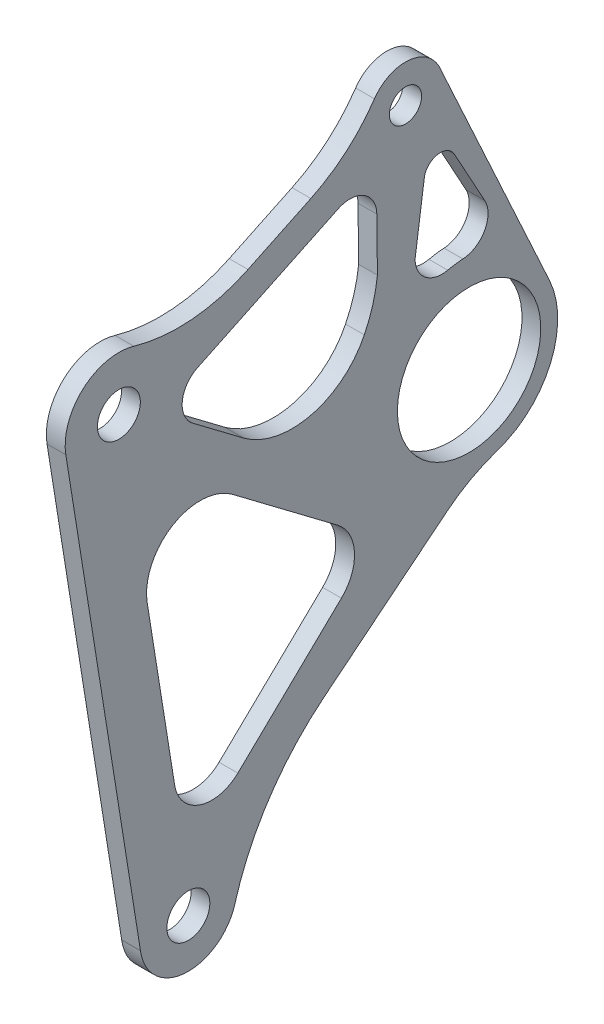
from build123d import *

# Parameters (mm, degrees)
SZKIC7_W                    = 139.266717109
SZKIC7_H                    = 160.929145335
DODANIE_WYCI_GNI_CIE2_DEPTH = 3.5
SZKIC8_R                    = 13.35
SZKIC8_R_2                  = 3
SZKIC8_R_3                  = 4
WYTNIJ_WYCI_GNI_CIE4_DEPTH  = 129.67294198
SZKIC9_W                    = 153.512733411
SZKIC9_H                    = 228.238191402
WYTNIJ_WYCI_GNI_CIE5_DEPTH  = 129.67294198
WYTNIJ_WYCI_GNI_CIE14_DEPTH = 104.40635377
WYTNIJ_WYCI_GNI_CIE15_DEPTH = 104.40635377
ZAOKR_GLENIE11_R            = 30
DODANIE_WYCI_GNI_CIE5_DEPTH = 3.5
ZAOKR_GLENIE14_R            = 5
WYTNIJ_WYCI_GNI_CIE17_DEPTH = 104.40635377
DODANIE_WYCI_GNI_CIE6_DEPTH = 3.5
ZAOKR_GLENIE24_R            = 5
DODANIE_WYCI_GNI_CIE7_DEPTH = 3.5
WYTNIJ_WYCI_GNI_CIE19_START = -10
WYTNIJ_WYCI_GNI_CIE19_DEPTH = 10
ZAOKR_GLENIE45_R            = 50
ZAOKR_GLENIE46_R            = 5
ZAOKR_GLENIE49_R            = 7
DODANIE_WYCI_GNI_CIE8_DEPTH = 3.5
ZAOKR_GLENIE61_R            = 3
ZAOKR_GLENIE62_R            = 5
WYTNIJ_WYCI_GNI_CIE21_DEPTH = 104.40635377
ZAOKR_GLENIE69_R            = 30
ZAOKR_GLENIE72_R            = 10
ZAOKR_GLENIE75_R            = 5
ZAOKR_GLENIE76_R            = 8
ZAOKR_GLENIE77_R            = 15


with BuildPart() as part:
    # Szkic7 → Dodanie-wyciągnięcie2 (new body)
    with BuildSketch(Plane(origin=(-10.54007835, 1.1e-07, -2.52e-07), x_dir=(-2.3878901828089376e-08, 0, 0.9999999999999998), z_dir=(-0.9999999999999998, 1.0404070824565065e-08, -2.387890182808938e-08))):
        with Locations((21.253283054, -10.552427612)):
            Rectangle(SZKIC7_W, SZKIC7_H)
    extrude(amount=DODANIE_WYCI_GNI_CIE2_DEPTH)

    # Szkic8 → Wytnij-wyciągnięcie4 (cut, through all)
    with BuildSketch(Plane(origin=(-14.04007835, 1.46e-07, -3.35e-07), x_dir=(-2.3878901828089376e-08, 0, 0.9999999999999998), z_dir=(-0.9999999999999998, 1.0404070821366677e-08, -2.387890182808938e-08))):
        Circle(SZKIC8_R)
        with Locations((11.844583319, 48.576803579)):
            Circle(SZKIC8_R_2)
        with Locations((65.219786586, 25.423993346)):
            Circle(SZKIC8_R_3)
        with Locations((52.278664472, -61.870358339)):
            Circle(SZKIC8_R_3)
    extrude(amount=-WYTNIJ_WYCI_GNI_CIE4_DEPTH, mode=Mode.SUBTRACT)

    # Szkic9 → Wytnij-wyciągnięcie5 (cut, through all)
    with BuildSketch(Plane(origin=(-14.04007835, 1.46e-07, -3.35e-07), x_dir=(-2.3878901828089376e-08, 0, 0.9999999999999998), z_dir=(-0.9999999999999998, 1.04040708213667e-08, -2.387890182808938e-08))):
        with Locations((22.662126008, 15.447874068)):
            Rectangle(SZKIC9_W, SZKIC9_H)
        with BuildLine():
            Line((-13.382127281, -14.863333052), (46.256707196, -68.558858213))
            ThreePointArc((46.256707196, -68.558858213), (55.372975766, -70.321703653), (61.195751969, -63.089189983))
            Line((61.195751969, -63.089189983), (75.094385693, 23.845293729))
            ThreePointArc((75.094385693, 23.845293729), (73.861369629, 30.456193909), (68.720255549, 34.79131511))
            Line((68.720255549, 34.79131511), (14.519431503, 55.045589184))
            ThreePointArc((14.519431503, 55.045589184), (9.521665371, 55.180140024), (5.708860939, 51.946211669))
            Line((5.708860939, 51.946211669), (-17.530635372, 9.626880256))
            ThreePointArc((-17.530635372, 9.626880256), (-19.719086203, -3.340305273), (-13.382127281, -14.863333052))
        make_face(mode=Mode.SUBTRACT)
    extrude(amount=-WYTNIJ_WYCI_GNI_CIE5_DEPTH, mode=Mode.SUBTRACT)

    # Szkic14 → Wytnij-wyciągnięcie14 (cut, through all)
    with BuildSketch(Plane(origin=(-10.54007835, 1.1e-07, -2.52e-07), x_dir=(2.3878901828089376e-08, 0, -0.9999999999999998), z_dir=(0.9999999999999998, -1.0404070821258326e-08, 2.387890182808938e-08))):
        with BuildLine():
            Line((-64.084108782, 18.320448812), (-52.714951988, -52.792424274))
            Line((-52.714951988, -52.792424274), (-32.631950605, -33.45407936))
            Line((-32.631950605, -33.45407936), (-18.993828244, -20.321644163))
            Line((-18.993828244, -20.321644163), (-23.497433394, -7.529972113))
            ThreePointArc((-23.497433394, -7.529972113), (-20.22176145, 0.243476392), (-16.722321984, 7.918790833))
            ThreePointArc((-16.722321984, 7.918790833), (-6.217208555, 17.426692703), (7.933812077, 16.715200469))
            Line((7.933812077, 16.715200469), (0.329933976, 30.561930754))
            Line((0.329933976, 30.561930754), (-5.626615834, 41.408861433))
            Line((-5.626615834, 41.408861433), (-64.084108782, 18.320448812))
        make_face()
    extrude(amount=-WYTNIJ_WYCI_GNI_CIE14_DEPTH, mode=Mode.SUBTRACT)

    # Szkic18 → Wytnij-wyciągnięcie15 (cut, through all)
    with BuildSketch(Plane(origin=(-10.54007835, 1.1e-07, -2.52e-07), x_dir=(2.3878901833219947e-08, 0, -0.9999999999999997), z_dir=(0.9999999999999997, -1.0404070824107121e-08, 2.3878901833219954e-08))):
        with BuildLine():
            Line((-56.144678545, 29.624280722), (-18.759552018, 47.489049981))
            ThreePointArc((-18.759552018, 47.489049981), (-17.902798902, 52.083657433), (-14.345263169, 55.114892007))
            Line((-14.345263169, 55.114892007), (-18.275031936, 65.389368248))
            Line((-18.275031936, 65.389368248), (-73.458270167, 44.282952603))
            Line((-73.458270167, 44.282952603), (-68.840695847, 34.74542114))
            ThreePointArc((-68.840695847, 34.74542114), (-61.478985752, 34.697957391), (-56.144678545, 29.624280722))
        make_face()
    extrude(amount=-WYTNIJ_WYCI_GNI_CIE15_DEPTH, mode=Mode.SUBTRACT)

    # Zaokrąglenie11
    zaokr_glenie11_edges = [part.edges().sort_by_distance(p)[0] for p in [
        (-12.290078304, 47.489050108, 18.759551724),
        (-12.290079383, 29.62428085, 56.144678252),
    ]]
    fillet(zaokr_glenie11_edges, radius=ZAOKR_GLENIE11_R)

    # Szkic19 → Dodanie-wyciągnięcie5 (add)
    with BuildSketch(Plane(origin=(-10.54007835, 1.1e-07, -2.52e-07), x_dir=(2.3878901833219947e-08, 0, -0.9999999999999997), z_dir=(0.9999999999999997, -1.0404070824107115e-08, 2.3878901833219954e-08))):
        Polygon((-58.946047974, 22.777610248), (-66.322773152, 19.747008618), (-66.720640825, 19.033728733), (-20.22726344, -16.008684341), (-16.035438929, -9.564443008), align=None)
    extrude(amount=-DODANIE_WYCI_GNI_CIE5_DEPTH)

    # Zaokrąglenie14
    zaokr_glenie14_edges = [part.edges().sort_by_distance(p)[0] for p in [
        (-12.290077987, 16.715200597, -7.93381237),
    ]]
    fillet(zaokr_glenie14_edges, radius=ZAOKR_GLENIE14_R)

    # Szkic21 → Wytnij-wyciągnięcie17 (cut, through all)
    with BuildSketch(Plane(origin=(-10.54007835, 1.1e-07, -2.52e-07), x_dir=(2.3878901833219947e-08, 0, -0.9999999999999997), z_dir=(0.9999999999999997, -1.0404070824107095e-08, 2.3878901833219954e-08))):
        with BuildLine():
            Line((-57.747304238, 22.208602164), (-14.808308197, 42.727330539))
            ThreePointArc((-14.808308197, 42.727330539), (-10.724979425, 42.115651428), (-7.085527385, 44.065552465))
            Line((-7.085527385, 44.065552465), (-5.626615834, 41.408861433))
            Line((-5.626615834, 41.408861433), (-56.83244455, 21.184571229))
            Line((-56.83244455, 21.184571229), (-58.018162719, 22.09497171))
            Line((-58.018162719, 22.09497171), (-57.747304238, 22.208602164))
        make_face()
    extrude(amount=-WYTNIJ_WYCI_GNI_CIE17_DEPTH, mode=Mode.SUBTRACT)

    # Szkic22 → Dodanie-wyciągnięcie6 (add)
    with BuildSketch(Plane(origin=(-14.04007835, 1.46e-07, -3.35e-07), x_dir=(-2.3878901833219947e-08, 0, 0.9999999999999997), z_dir=(-0.9999999999999997, 1.0404070824107088e-08, -2.3878901833219954e-08))):
        Polygon((17.312164793, 44.627828311), (16.881727623, 7.573016126), (9.920276091, 10.932172716), (10.31169253, 44.627828311), align=None)
    extrude(amount=-DODANIE_WYCI_GNI_CIE6_DEPTH)

    # Zaokrąglenie24
    zaokr_glenie24_edges = [part.edges().sort_by_distance(p)[0] for p in [
        (-12.290078426, 15.583851379, 9.974310759),
    ]]
    fillet(zaokr_glenie24_edges, radius=ZAOKR_GLENIE24_R)

    # Szkic24 → Dodanie-wyciągnięcie7 (add)
    with BuildSketch(Plane(origin=(-10.54007835, 1.1e-07, -2.52e-07), x_dir=(2.3878901833219947e-08, 0, -0.9999999999999997), z_dir=(0.9999999999999997, -1.0404070824107058e-08, 2.3878901833219954e-08))):
        with BuildLine():
            Line((-36.816395524, 1.75323141), (-22.747516876, -7.1896775))
            Line((-22.747516876, -7.1896775), (-16.897223685, -9.883462439))
            Line((-16.897223685, -9.883462439), (-13.267833736, 11.506726098))
            Line((-13.267833736, 11.506726098), (-17.070297429, 23.806323206))
            ThreePointArc((-17.070297429, 23.806323206), (-23.405276733, 9.611828212), (-36.816395524, 1.75323141))
        make_face()
    extrude(amount=-DODANIE_WYCI_GNI_CIE7_DEPTH)

    # Szkic15 → Wytnij-wyciągnięcie19 (cut)
    with BuildSketch(Plane(origin=(-10.54007835, 1.1e-07, -2.52e-07), x_dir=(2.3878901833219947e-08, 0, -0.9999999999999997), z_dir=(0.9999999999999997, -1.040407082410717e-08, 2.3878901833219954e-08)).offset(WYTNIJ_WYCI_GNI_CIE19_START)):
        with BuildLine():
            Line((-46.247351401, -68.55043477), (13.382127281, -14.863333052))
            ThreePointArc((13.382127281, -14.863333052), (5.78541375, -19.144946794), (-2.911139806, -19.786997373))
            Line((-2.911139806, -19.786997373), (-46.469923975, -54.995874079))
            ThreePointArc((-46.469923975, -54.995874079), (-43.279874823, -61.722599619), (-46.247351401, -68.55043477))
        make_face()
    extrude(amount=WYTNIJ_WYCI_GNI_CIE19_DEPTH, mode=Mode.SUBTRACT)

    # Zaokrąglenie45
    zaokr_glenie45_edges = [part.edges().sort_by_distance(p)[0] for p in [
        (-12.290080032, -54.995873951, 46.469923682),
    ]]
    fillet(zaokr_glenie45_edges, radius=ZAOKR_GLENIE45_R)

    # Zaokrąglenie46
    # the kernel refuses this fillet: 5 mm, written as the material it adds along each edge
    with BuildSketch(Plane(origin=(-14.040080468, -63.089189837, 61.195751634), x_dir=(-7.0180139349827484e-09, -0.9904804440406619, -0.13765351420509783), z_dir=(0.9999999999999997, -1.04040708213667e-08, 2.3878901828089376e-08))) as zaokr_glenie46_piece_1:
        with BuildLine():
            CenterArc((0.051723223, -4.999987357), ZAOKR_GLENIE46_R, 90.128848909, 1.042345949)
            Line((-0.050475691, -0.001031928), (0, 0))
            ThreePointArc((0, 0), (0.020239522, -2.2758e-05), (0.040479044, 0))
        make_face()
    extrude(amount=3.5)

    # Zaokrąglenie49
    zaokr_glenie49_edges = [part.edges().sort_by_distance(p)[0] for p in [
        (-12.290080158, -52.792424146, 52.714951695),
    ]]
    fillet(zaokr_glenie49_edges, radius=ZAOKR_GLENIE49_R)

    # Szkic26 → Dodanie-wyciągnięcie8 (add)
    with BuildSketch(Plane(origin=(-10.54007835, 1.1e-07, -2.52e-07), x_dir=(2.3878901833219947e-08, 0, -0.9999999999999997), z_dir=(0.9999999999999997, -1.0404070824107146e-08, 2.3878901833219954e-08))):
        Polygon((-7.085527385, 44.065552465), (-10.059220211, 22.893380097), (-14.304391944, 31.138416493), (-12.581544758, 43.40478687), align=None)
    extrude(amount=-DODANIE_WYCI_GNI_CIE8_DEPTH)

    # Zaokrąglenie61
    zaokr_glenie61_edges = [part.edges().sort_by_distance(p)[0] for p in [
        (-12.290078061, 44.065552593, 7.085527092),
    ]]
    fillet(zaokr_glenie61_edges, radius=ZAOKR_GLENIE61_R)

    # Zaokrąglenie62
    zaokr_glenie62_edges = [part.edges().sort_by_distance(p)[0] for p in [
        (-12.290078331, 41.547939767, 17.276387809),
    ]]
    fillet(zaokr_glenie62_edges, radius=ZAOKR_GLENIE62_R)

    # Szkic28 → Wytnij-wyciągnięcie21 (cut, through all)
    with BuildSketch(Plane(origin=(-10.54007835, 1.1e-07, -2.52e-07), x_dir=(2.3878901833219947e-08, 0, -0.9999999999999997), z_dir=(0.9999999999999997, -1.0404070824107156e-08, 2.3878901833219954e-08))):
        with BuildLine():
            Line((-5.482778627, 51.496981839), (14.995682487, 6.883277326))
            ThreePointArc((14.995682487, 6.883277326), (14.189845026, -8.420112715), (1.143833134, -16.460305154))
            Line((1.143833134, -16.460305154), (-2.911139806, -19.786997373))
            ThreePointArc((-2.911139806, -19.786997373), (16.423351118, -11.413743385), (17.530635372, 9.626880256))
            Line((17.530635372, 9.626880256), (-5.458225211, 51.489801759))
            Line((-5.458225211, 51.489801759), (-5.482778627, 51.496981839))
        make_face()
    extrude(amount=-WYTNIJ_WYCI_GNI_CIE21_DEPTH, mode=Mode.SUBTRACT)

    # Zaokrąglenie69
    zaokr_glenie69_edges = [part.edges().sort_by_distance(p)[0] for p in [
        (-12.290078494, -16.460305026, -1.143833428),
    ]]
    fillet(zaokr_glenie69_edges, radius=ZAOKR_GLENIE69_R)

    # Zaokrąglenie72
    # the kernel refuses this fillet: 10 mm, written as the material it adds along each edge
    with BuildSketch(Plane(origin=(-10.540079015, -20.321644054, 18.993827992), x_dir=(-2.4417350092824874e-08, -0.6936260242852466, 0.7203352958409311), z_dir=(-0.9999999999999998, 1.0404070821258326e-08, -2.387890182808938e-08))) as zaokr_glenie72_piece_1:
        with BuildLine():
            CenterArc((6.286783652, 10), ZAOKR_GLENIE72_R, 213.765114836, 56.234885164)
            Line((-2.026446567, 4.442104416), (-2.192711171, 4.330946504))
            ThreePointArc((-2.192711171, 4.330946504), (-1.195183636, 2.138043594), (-0.181960353, -0.083008614))
            Line((-0.181960353, -0.083008614), (0, -0.2))
            Line((0, -0.2), (6.286783652, -0.2))
            Line((6.286783652, -0.2), (6.286783652, 0))
        make_face()
    extrude(amount=3.5)
    with BuildSketch(Plane(origin=(-14.0400797, 16.872020607, 63.852541245), x_dir=(-6.503841534045875e-09, -0.9874599106733049, -0.1578699617187155), z_dir=(0.9999999999999997, -1.0404070828894181e-08, 2.38789018268686e-08))) as zaokr_glenie72_piece_2:
        with BuildLine():
            CenterArc((ZAOKR_GLENIE72_R * 2.4806255413, ZAOKR_GLENIE72_R), ZAOKR_GLENIE72_R, 133.911105356, 136.088894644)
            Line((ZAOKR_GLENIE72_R * 1.78708406522, ZAOKR_GLENIE72_R * 1.72041669952), (ZAOKR_GLENIE72_R * 1.7732132357, ZAOKR_GLENIE72_R * 1.73482503351))
            Line((ZAOKR_GLENIE72_R * 1.7732132357, ZAOKR_GLENIE72_R * 1.73482503351), (-ZAOKR_GLENIE72_R * 0.0138708295217, ZAOKR_GLENIE72_R * 0.0144083339905))
            Line((-ZAOKR_GLENIE72_R * 0.0138708295217, ZAOKR_GLENIE72_R * 0.0144083339905), (0, -ZAOKR_GLENIE72_R * 0.02))
            Line((0, -ZAOKR_GLENIE72_R * 0.02), (ZAOKR_GLENIE72_R * 2.4806255413, -ZAOKR_GLENIE72_R * 0.02))
            Line((ZAOKR_GLENIE72_R * 2.4806255413, -ZAOKR_GLENIE72_R * 0.02), (ZAOKR_GLENIE72_R * 2.4806255413, 0))
        make_face()
    extrude(amount=3.5)

    # Zaokrąglenie75
    zaokr_glenie75_edges = [part.edges().sort_by_distance(p)[0] for p in [
        (-12.290079506, 22.094971838, 58.018162426),
    ]]
    fillet(zaokr_glenie75_edges, radius=ZAOKR_GLENIE75_R)

    # Zaokrąglenie76
    zaokr_glenie76_edges = [part.edges().sort_by_distance(p)[0] for p in [
        (-12.290079006, -15.716243361, 20.615266189),
    ]]
    fillet(zaokr_glenie76_edges, radius=ZAOKR_GLENIE76_R)

    # Zaokrąglenie77
    zaokr_glenie77_edges = [part.edges().sort_by_distance(p)[0] for p in [
        (-12.290079101, 3.02881083, 32.74384556),
    ]]
    fillet(zaokr_glenie77_edges, radius=ZAOKR_GLENIE77_R)


solid = part.part
